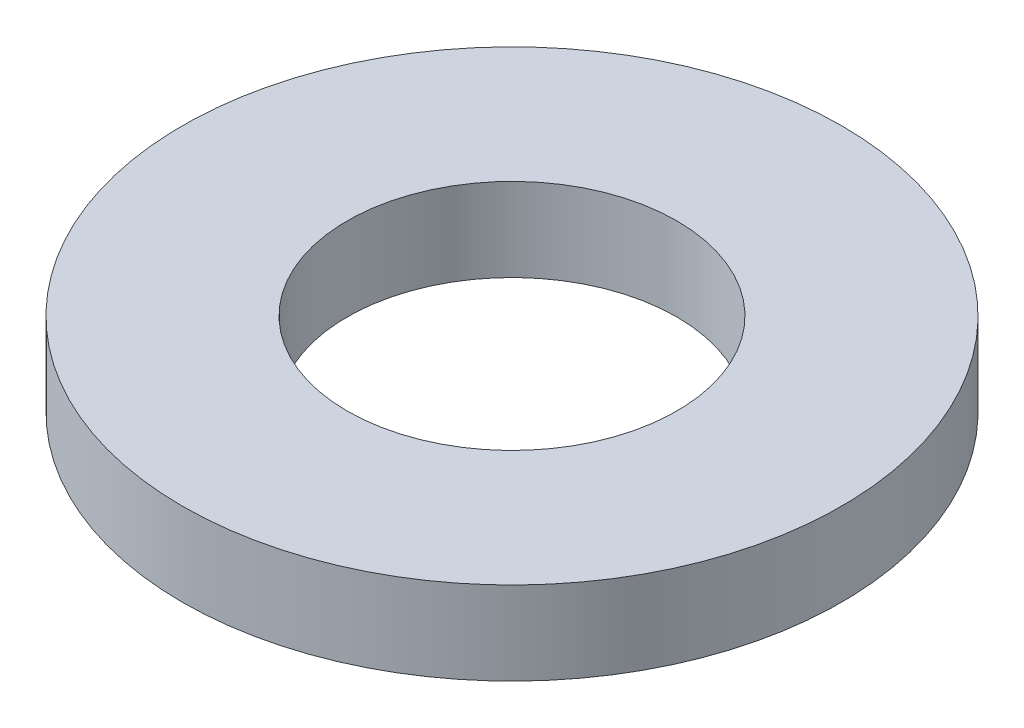
from build123d import *

# Parameters (mm, degrees)
SKETCH1_R           = 95
BOSS_EXTRUDE1_DEPTH = 24
SKETCH2_R           = 47.5
CUT_EXTRUDE1_DEPTH  = 137.477104307


with BuildPart() as part:
    # Sketch1 → Boss-Extrude1 (new body)
    with BuildSketch(Plane(origin=(0, 0, 0), x_dir=(1, 0, 0), z_dir=(0, 1, 0))):
        Circle(SKETCH1_R)
    extrude(amount=BOSS_EXTRUDE1_DEPTH)

    # Sketch2 → Cut-Extrude1 (cut, through all)
    with BuildSketch(Plane(origin=(0, 0, 0), x_dir=(1, 0, 0), z_dir=(0, 1, 0))):
        Circle(SKETCH2_R)
    extrude(amount=CUT_EXTRUDE1_DEPTH, mode=Mode.SUBTRACT)


solid = part.part
